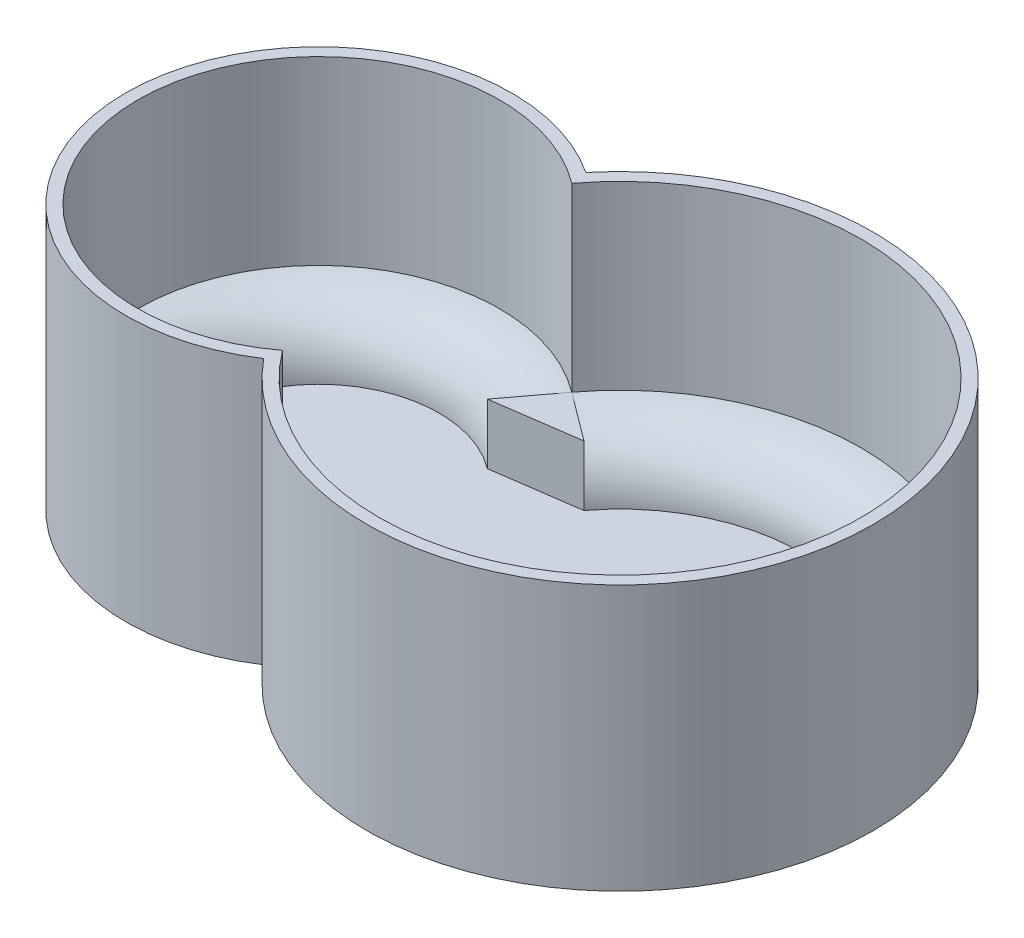
from build123d import *

# Parameters (mm, degrees)
EXTRUDE_1_DEPTH = 20
EXTRUDE_START   = -2
SKETCH_1_3_R    = 16
SKETCH_1_3_R_2  = 21
EXTRUDE_2_DEPTH = 2
SWEEP_1_ANGLE   = 286.260205
EXTRUDE_4_DEPTH = 5
EXTRUDE_5_DEPTH = 5


# Read off the part's stored shape, not the designer's step: По траектории1
with BuildPart() as part:
    # Эскиз1 → Бобышка-Вытянуть1 (new body)
    with BuildSketch(Plane(origin=(0, 0, 0), x_dir=(1, 0, 0), z_dir=(0, 1, 0))):
        with BuildLine():
            ThreePointArc((-15.332019477, -0.360375994), (-30.332019477, 14.639624006), (-15.332019477, 29.639624006))
            Line((-15.332019477, 29.639624006), (-15.332019477, 30.639624006))
            ThreePointArc((-15.332019477, 30.639624006), (-31.332019477, 14.639624006), (-15.332019477, -1.360375994))
            Line((-15.332019477, -1.360375994), (-15.332019477, -0.360375994))
        make_face()
        with BuildLine():
            Line((-15.332019477, 30.639624006), (-15.332019477, 29.639624006))
            ThreePointArc((-15.332019477, 29.639624006), (-11.459036131, 29.131000752), (-7.848704703, 27.639624006))
            Line((-7.848704703, 27.639624006), (-6.824441979, 27.639624006))
            ThreePointArc((-6.824441979, 27.639624006), (-6.679236311, 27.821752127), (-6.532019477, 28.002258477))
            ThreePointArc((-6.532019477, 28.002258477), (-10.738662944, 29.96610683), (-15.332019477, 30.639624006))
        make_face()
        with BuildLine():
            ThreePointArc((-7.848704703, 1.639624006), (-11.459036131, 0.14824726), (-15.332019477, -0.360375994))
            Line((-15.332019477, -0.360375994), (-15.332019477, -1.360375994))
            ThreePointArc((-15.332019477, -1.360375994), (-10.738662944, -0.686858818), (-6.532019477, 1.276989535))
            ThreePointArc((-6.532019477, 1.276989535), (-6.679236311, 1.457495885), (-6.824441979, 1.639624006))
            Line((-6.824441979, 1.639624006), (-7.848704703, 1.639624006))
        make_face()
        with BuildLine():
            ThreePointArc((-6.004640424, 1.639624006), (-6.266516525, 1.455669507), (-6.532019477, 1.276989535))
            ThreePointArc((-6.532019477, 1.276989535), (0.712963044, -4.355313792), (9.667980523, -6.360375994))
            Line((9.667980523, -6.360375994), (9.667980523, -5.360375994))
            ThreePointArc((9.667980523, -5.360375994), (1.301380258, -3.526278119), (-5.53070363, 1.639624006))
            Line((-5.53070363, 1.639624006), (-6.004640424, 1.639624006))
        make_face()
        with BuildLine():
            ThreePointArc((30.667980523, 14.639624006), (16.767276263, 34.403226916), (-6.532019477, 28.002258477))
            ThreePointArc((-6.532019477, 28.002258477), (-6.266516525, 27.823578505), (-6.004640424, 27.639624006))
            Line((-6.004640424, 27.639624006), (-5.53070363, 27.639624006))
            ThreePointArc((-5.53070363, 27.639624006), (16.597133319, 33.400936368), (29.667980523, 14.639624006))
            ThreePointArc((29.667980523, 14.639624006), (23.810116147, 0.497488382), (9.667980523, -5.360375994))
            Line((9.667980523, -5.360375994), (9.667980523, -6.360375994))
            ThreePointArc((9.667980523, -6.360375994), (24.517222928, -0.209618399), (30.667980523, 14.639624006))
        make_face()
        with BuildLine():
            ThreePointArc((-6.532019477, 28.002258477), (-6.679236311, 27.821752127), (-6.824441979, 27.639624006))
            Line((-6.824441979, 27.639624006), (-6.004640424, 27.639624006))
            ThreePointArc((-6.004640424, 27.639624006), (-6.266516525, 27.823578505), (-6.532019477, 28.002258477))
        make_face()
        with BuildLine():
            Line((-6.824441979, 27.639624006), (-7.848704703, 27.639624006))
            ThreePointArc((-7.848704703, 27.639624006), (-7.497456441, 27.431012595), (-7.152019477, 27.212913154))
            ThreePointArc((-7.152019477, 27.212913154), (-6.989597145, 27.427317552), (-6.824441979, 27.639624006))
        make_face()
        with BuildLine():
            ThreePointArc((-6.824441979, 27.639624006), (-6.989597145, 27.427317552), (-7.152019477, 27.212913154))
            ThreePointArc((-7.152019477, 27.212913154), (-6.737238205, 26.933107438), (-6.332019477, 26.639624006))
            ThreePointArc((-6.332019477, 26.639624006), (-6.02692778, 27.035988527), (-5.712019477, 27.424599563))
            ThreePointArc((-5.712019477, 27.424599563), (-5.857719918, 27.532941961), (-6.004640424, 27.639624006))
            Line((-6.004640424, 27.639624006), (-6.824441979, 27.639624006))
        make_face()
        with BuildLine():
            Line((-5.53070363, 27.639624006), (-6.004640424, 27.639624006))
            ThreePointArc((-6.004640424, 27.639624006), (-5.857719918, 27.532941961), (-5.712019477, 27.424599563))
            ThreePointArc((-5.712019477, 27.424599563), (-5.621739553, 27.532430527), (-5.53070363, 27.639624006))
        make_face()
        with BuildLine():
            ThreePointArc((-6.332019477, 2.639624006), (-6.737238205, 2.346140574), (-7.152019477, 2.066334858))
            ThreePointArc((-7.152019477, 2.066334858), (-6.989597145, 1.85193046), (-6.824441979, 1.639624006))
            Line((-6.824441979, 1.639624006), (-6.004640424, 1.639624006))
            ThreePointArc((-6.004640424, 1.639624006), (-5.857719918, 1.746306051), (-5.712019477, 1.854648449))
            ThreePointArc((-5.712019477, 1.854648449), (-6.02692778, 2.243259485), (-6.332019477, 2.639624006))
        make_face()
        with BuildLine():
            ThreePointArc((-7.152019477, 2.066334858), (-7.497456441, 1.848235417), (-7.848704703, 1.639624006))
            Line((-7.848704703, 1.639624006), (-6.824441979, 1.639624006))
            ThreePointArc((-6.824441979, 1.639624006), (-6.989597145, 1.85193046), (-7.152019477, 2.066334858))
        make_face()
        with BuildLine():
            Line((-6.004640424, 1.639624006), (-6.824441979, 1.639624006))
            ThreePointArc((-6.824441979, 1.639624006), (-6.679236311, 1.457495885), (-6.532019477, 1.276989535))
            ThreePointArc((-6.532019477, 1.276989535), (-6.266516525, 1.455669507), (-6.004640424, 1.639624006))
        make_face()
        with BuildLine():
            ThreePointArc((-5.712019477, 1.854648449), (-5.857719918, 1.746306051), (-6.004640424, 1.639624006))
            Line((-6.004640424, 1.639624006), (-5.53070363, 1.639624006))
            ThreePointArc((-5.53070363, 1.639624006), (-5.621739553, 1.746817485), (-5.712019477, 1.854648449))
        make_face()
    extrude(amount=EXTRUDE_1_DEPTH)

    # Эскиз1<3> → Бобышка-Вытянуть2 (add)
    with BuildSketch(Plane(origin=(0, 0, 0), x_dir=(1, 0, 0), z_dir=(0, 1, 0)).offset(EXTRUDE_START)):
        with Locations((-15.332019477, 14.639624006)):
            Circle(SKETCH_1_3_R)
        with Locations((9.667980523, 14.639624006)):
            Circle(SKETCH_1_3_R_2)
    extrude(amount=EXTRUDE_2_DEPTH)

    # По траектории1 outline → По траектории1 (revolve)
    with BuildSketch(Plane(origin=(9.667980523, 0, -14.639624006), x_dir=(-0.7999999999999995, 0, 0.6000000000000008), z_dir=(-0.6000000000000008, 0, -0.7999999999999995))):
        with BuildLine():
            ThreePointArc((20, 5), (16.464466094, 3.535533906), (15, 0))
            Line((15, 0), (20, 0))
            Line((20, 0), (20, 5))
        make_face()
    revolve(axis=Axis((9.667980523, 0, -14.639624006), (0, 1, 0)), revolution_arc=SWEEP_1_ANGLE)

    # По траектории9: sweep along a curve in space
    with BuildLine() as sweep_9_path:
        ThreePointArc((-6.332019477, 0, -26.639624006), (-30.332019477, 0, -14.639624006), (-6.332019477, 0, -2.639624006))
    # Sketch 5 → По траектории9 (sweep)
    with BuildSketch(Plane(origin=(-30.332019477, 0, -14.639624006), x_dir=(1, 0, 0), z_dir=(0, 0, 1))):
        with BuildLine():
            Line((0, 0), (5, 0))
            ThreePointArc((5, 0), (3.535533906, 3.535533906), (0, 5))
            Line((0, 5), (0, 0))
        make_face()
    sweep(path=sweep_9_path.line)

    # Эскиз17 → Бобышка-Вытянуть4 (add)
    with BuildSketch(Plane(origin=(0, 0, 0), x_dir=(1, 0, 0), z_dir=(0, 1, 0))):
        Polygon((-9.332019477, 6.639624006), (-2.332019477, 5.639624006), (-6.332019477, 2.639624006), align=None)
    extrude(amount=EXTRUDE_4_DEPTH)

    # Эскиз19 → Бобышка-Вытянуть5 (add)
    with BuildSketch(Plane(origin=(0, 0, 0), x_dir=(1, 0, 0), z_dir=(0, 1, 0))):
        Polygon((-2.332019477, 23.639624006), (-9.332019477, 22.639624006), (-6.332019477, 26.639624006), align=None)
    extrude(amount=EXTRUDE_5_DEPTH)


solid = part.part
